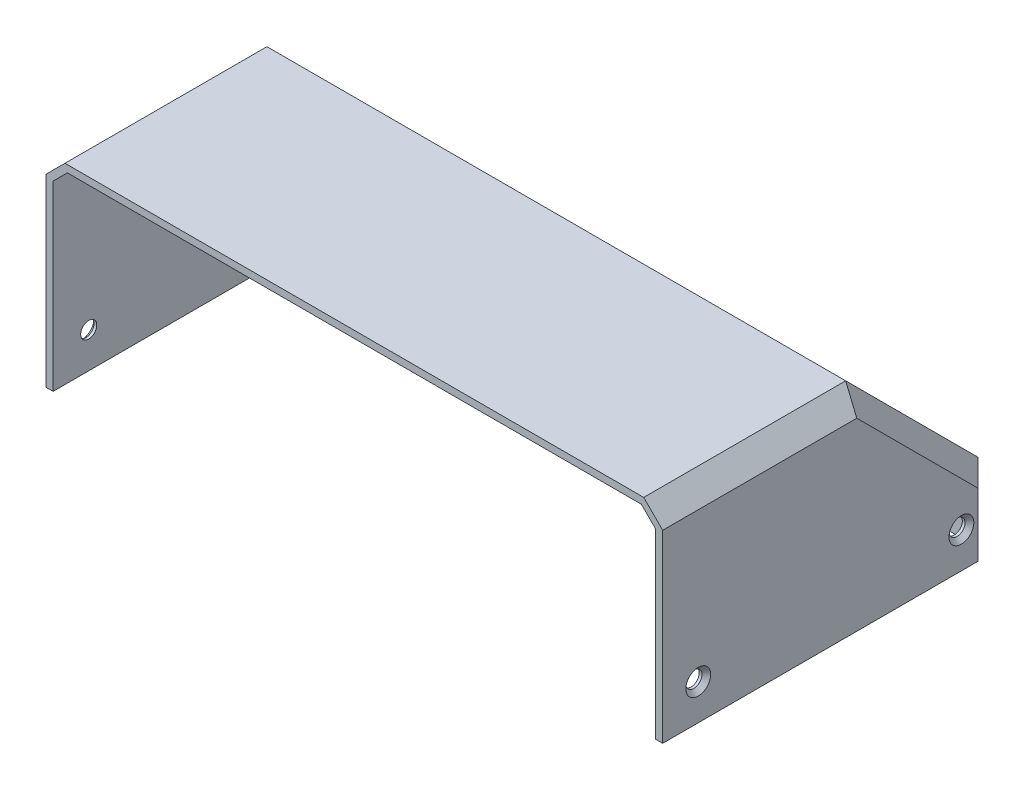
from build123d import *

# Parameters (mm, degrees)
BOSS_EXTRUDE1_DEPTH             = 82.5383335
CUT_EXTRUDE1_DEPTH              = 80.633333
CUT_EXTRUDE1_DEPTH_BACK         = 80.633333
CHAMFER1_SIZE                   = 3.81
CHAMFER2_SIZE                   = 5.08
CUT_EXTRUDE2_REACH              = 114.703
FILL_START                      = 74.838023578
FILL_PATTERN1_DEPTH             = 1.905
F_6_CLEARANCE_HOLE1_D           = 4.3053
F_6_CLEARANCE_HOLE1_DEPTH       = 6.858
F_6_CLEARANCE_HOLE1_CSINK_D     = 6.6548
F_6_CLEARANCE_HOLE1_CSINK_ANGLE = 90
F_6_CLEARANCE_HOLE1_TIP         = 1.293442612
F_6_CLEARANCE_HOLE2_D           = 4.3053
F_6_CLEARANCE_HOLE2_DEPTH       = 6.858
F_6_CLEARANCE_HOLE2_CSINK_D     = 6.6548
F_6_CLEARANCE_HOLE2_CSINK_ANGLE = 90
F_6_CLEARANCE_HOLE2_TIP         = 1.293442612


# Read off the part's stored shape, not the designer's step: Fill Pattern1
with BuildPart() as part:
    # Sketch1 → Boss-Extrude1 (new, symmetric)
    with BuildSketch(Plane(origin=(0, 0, 0), x_dir=(0, 0, -1), z_dir=(1, 0, 0))):
        Polygon((0, 0), (89.481024762, 0), (89.481024762, 19.05), (54.056025762, 54.474999), (0, 54.474999), align=None)
    extrude(amount=BOSS_EXTRUDE1_DEPTH, both=True)

    # Sketch3 → Cut-Extrude1 (cut, two sides: drawn at the far end of the back side and taken through both)
    with BuildSketch(Plane(origin=(0, 51.807175117, 0), x_dir=(0, 0, 1), z_dir=(-1, 0, 0)).offset(-CUT_EXTRUDE1_DEPTH_BACK)):
        Polygon((-87.576024762, -51.807175117), (0, -51.807175117), (0, 0.762823883), (-53.266948926, 0.762823883), (-87.576024762, -33.546251954), align=None)
    extrude(amount=CUT_EXTRUDE1_DEPTH + CUT_EXTRUDE1_DEPTH_BACK, mode=Mode.SUBTRACT)

    # Chamfer1
    chamfer1_edges = [part.edges().sort_by_distance(p)[0] for p in [
        (-80.633333, 9.130461582, -87.576024762),
        (80.633333, 9.130461582, -87.576024762),
        (-80.633333, 35.415461082, -70.421486844),
        (80.633333, 35.415461082, -70.421486844),
        (-80.633333, 52.569999, -26.633474463),
        (80.633333, 52.569999, -26.633474463),
    ]]
    chamfer(chamfer1_edges, length=CHAMFER1_SIZE)

    # Chamfer2
    chamfer2_edges = [part.edges().sort_by_distance(p)[0] for p in [
        (82.5383335, 9.525, -89.481024762),
        (82.5383335, 36.7624995, -71.768525262),
        (82.5383335, 54.474999, -27.028012881),
        (-82.5383335, 54.474999, -27.028012881),
        (-82.5383335, 36.7624995, -71.768525262),
        (-82.5383335, 9.525, -89.481024762),
    ]]
    chamfer(chamfer2_edges, length=CHAMFER2_SIZE)

    # Sketch10 → Cut-Extrude2 (cut, up to next)
    with BuildSketch(Plane(origin=(0, 54.265512381, -54.265512381), x_dir=(1, 0, 0), z_dir=(0, 0.7071067811865515, -0.7071067811865436)), mode=Mode.PRIVATE) as cut_extrude2_sk1:
        Polygon((4.618802155, 24.752998199), (2.309401077, 28.7529982), (-2.309401077, 28.7529982), (-4.618802155, 24.752998199), (-2.309401077, 20.752998198), (2.309401077, 20.752998198), align=None)
    cut_extrude2_tool1 = extrude(cut_extrude2_sk1.sketch, amount=-CUT_EXTRUDE2_REACH, mode=Mode.PRIVATE) & part.part
    add(cut_extrude2_tool1.solids().sort_by_distance((0, 36.7625, -71.768525))[0], mode=Mode.SUBTRACT)

    # Fill Pattern1 outline → Fill Pattern1 (cut)
    with BuildSketch(Plane(origin=(0, 0, 0), x_dir=(1, 0, 0), z_dir=(0, 0.707106781186551, -0.707106781186544)).offset(FILL_START)):
        Polygon((6.350853018, 35.752998297), (10.969655172, 35.752998297), (13.27905625, 39.752998298), (10.969655172, 43.752998299), (6.350853018, 43.752998299), (4.04145194, 39.752998298), align=None)
        Polygon((-10.969655172, 5.752998099), (-6.350853018, 5.752998099), (-4.04145194, 9.7529981), (-6.350853018, 13.752998101), (-10.969655172, 13.752998101), (-13.27905625, 9.7529981), align=None)
        Polygon((-21.939310345, 24.752998199), (-19.629909267, 20.752998198), (-15.011107113, 20.752998198), (-12.701706035, 24.752998199), (-15.011107113, 28.7529982), (-19.629909267, 28.7529982), align=None)
        Polygon((-39.259818535, 24.752998199), (-36.950417457, 20.752998198), (-32.331615303, 20.752998198), (-30.022214225, 24.752998199), (-32.331615303, 28.7529982), (-36.950417457, 28.7529982), align=None)
        Polygon((-56.580326725, 24.752998199), (-54.270925647, 20.752998198), (-49.652123493, 20.752998198), (-47.342722415, 24.752998199), (-49.652123493, 28.7529982), (-54.270925647, 28.7529982), align=None)
        Polygon((47.342722415, 24.752998199), (49.652123493, 20.752998198), (54.270925647, 20.752998198), (56.580326725, 24.752998199), (54.270925647, 28.7529982), (49.652123493, 28.7529982), align=None)
        Polygon((30.022214225, 24.752998199), (32.331615303, 20.752998198), (36.950417457, 20.752998198), (39.259818535, 24.752998199), (36.950417457, 28.7529982), (32.331615303, 28.7529982), align=None)
        Polygon((12.701706035, 24.752998199), (15.011107113, 20.752998198), (19.629909267, 20.752998198), (21.939310345, 24.752998199), (19.629909267, 28.7529982), (15.011107113, 28.7529982), align=None)
        Polygon((-10.969655172, 43.752998299), (-13.27905625, 39.752998298), (-10.969655172, 35.752998297), (-6.350853018, 35.752998297), (-4.04145194, 39.752998298), (-6.350853018, 43.752998299), align=None)
        Polygon((6.350853018, 13.752998101), (4.04145194, 9.7529981), (6.350853018, 5.752998099), (10.969655172, 5.752998099), (13.27905625, 9.7529981), (10.969655172, 13.752998101), align=None)
        Polygon((-54.270925647, 40.75299833), (-49.652123493, 40.75299833), (-47.342722415, 44.752998331), (-49.652123493, 48.752998332), (-54.270925647, 48.752998332), (-56.580326725, 44.752998331), align=None)
        Polygon((-62.931179742, 25.752998231), (-58.312377588, 25.752998231), (-56.00297651, 29.752998232), (-58.312377588, 33.752998233), (-62.931179742, 33.752998233), (-65.24058082, 29.752998232), align=None)
        Polygon((12.701706035, 44.752998331), (15.011107113, 40.75299833), (19.629909267, 40.75299833), (21.939310345, 44.752998331), (19.629909267, 48.752998332), (15.011107113, 48.752998332), align=None)
        Polygon((30.022214225, 44.752998331), (32.331615303, 40.75299833), (36.950417457, 40.75299833), (39.259818535, 44.752998331), (36.950417457, 48.752998332), (32.331615303, 48.752998332), align=None)
        Polygon((-21.939310345, 44.752998331), (-19.629909267, 40.75299833), (-15.011107113, 40.75299833), (-12.701706035, 44.752998331), (-15.011107113, 48.752998332), (-19.629909267, 48.752998332), align=None)
        Polygon((-39.259818535, 44.752998331), (-36.950417457, 40.75299833), (-32.331615303, 40.75299833), (-30.022214225, 44.752998331), (-32.331615303, 48.752998332), (-36.950417457, 48.752998332), align=None)
        Polygon((-4.618802155, 44.752998331), (-2.309401077, 40.75299833), (2.309401077, 40.75299833), (4.618802155, 44.752998331), (2.309401077, 48.752998332), (-2.309401077, 48.752998332), align=None)
        Polygon((47.342722415, 44.752998331), (49.652123493, 40.75299833), (54.270925647, 40.75299833), (56.580326725, 44.752998331), (54.270925647, 48.752998332), (49.652123493, 48.752998332), align=None)
        Polygon((-36.950417457, 18.752998134), (-39.259818535, 14.752998133), (-36.950417457, 10.752998132), (-32.331615303, 10.752998132), (-30.022214225, 14.752998133), (-32.331615303, 18.752998134), align=None)
        Polygon((-45.610671552, 33.752998233), (-47.92007263, 29.752998232), (-45.610671552, 25.752998231), (-40.991869398, 25.752998231), (-38.68246832, 29.752998232), (-40.991869398, 33.752998233), align=None)
        Polygon((49.652123493, 0.752998066), (54.270925647, 0.752998066), (56.580326725, 4.752998067), (54.270925647, 8.752998068), (49.652123493, 8.752998068), (47.342722415, 4.752998067), align=None)
        Polygon((58.312377588, 15.752998165), (62.931179742, 15.752998165), (65.24058082, 19.752998166), (62.931179742, 23.752998167), (58.312377588, 23.752998167), (56.00297651, 19.752998166), align=None)
        Polygon((-56.580326725, 4.752998067), (-54.270925647, 0.752998066), (-49.652123493, 0.752998066), (-47.342722415, 4.752998067), (-49.652123493, 8.752998068), (-54.270925647, 8.752998068), align=None)
        Polygon((-4.618802155, 4.752998067), (-2.309401077, 0.752998066), (2.309401077, 0.752998066), (4.618802155, 4.752998067), (2.309401077, 8.752998068), (-2.309401077, 8.752998068), align=None)
        Polygon((30.022214225, 4.752998067), (32.331615303, 0.752998066), (36.950417457, 0.752998066), (39.259818535, 4.752998067), (36.950417457, 8.752998068), (32.331615303, 8.752998068), align=None)
        Polygon((12.701706035, 4.752998067), (15.011107113, 0.752998066), (19.629909267, 0.752998066), (21.939310345, 4.752998067), (19.629909267, 8.752998068), (15.011107113, 8.752998068), align=None)
        Polygon((-39.259818535, 4.752998067), (-36.950417457, 0.752998066), (-32.331615303, 0.752998066), (-30.022214225, 4.752998067), (-32.331615303, 8.752998068), (-36.950417457, 8.752998068), align=None)
        Polygon((-21.939310345, 4.752998067), (-19.629909267, 0.752998066), (-15.011107113, 0.752998066), (-12.701706035, 4.752998067), (-15.011107113, 8.752998068), (-19.629909267, 8.752998068), align=None)
        Polygon((40.991869398, 23.752998167), (38.68246832, 19.752998166), (40.991869398, 15.752998165), (45.610671552, 15.752998165), (47.92007263, 19.752998166), (45.610671552, 23.752998167), align=None)
        Polygon((32.331615303, 38.752998266), (30.022214225, 34.752998265), (32.331615303, 30.752998264), (36.950417457, 30.752998264), (39.259818535, 34.752998265), (36.950417457, 38.752998266), align=None)
        Polygon((-2.309401077, 30.752998264), (2.309401077, 30.752998264), (4.618802155, 34.752998265), (2.309401077, 38.752998266), (-2.309401077, 38.752998266), (-4.618802155, 34.752998265), align=None)
        Polygon((-10.969655172, 15.752998165), (-6.350853018, 15.752998165), (-4.04145194, 19.752998166), (-6.350853018, 23.752998167), (-10.969655172, 23.752998167), (-13.27905625, 19.752998166), align=None)
        Polygon((12.701706035, 34.752998265), (15.011107113, 30.752998264), (19.629909267, 30.752998264), (21.939310345, 34.752998265), (19.629909267, 38.752998266), (15.011107113, 38.752998266), align=None)
        Polygon((-39.259818535, 34.752998265), (-36.950417457, 30.752998264), (-32.331615303, 30.752998264), (-30.022214225, 34.752998265), (-32.331615303, 38.752998266), (-36.950417457, 38.752998266), align=None)
        Polygon((-56.580326725, 34.752998265), (-54.270925647, 30.752998264), (-49.652123493, 30.752998264), (-47.342722415, 34.752998265), (-49.652123493, 38.752998266), (-54.270925647, 38.752998266), align=None)
        Polygon((-21.939310345, 34.752998265), (-19.629909267, 30.752998264), (-15.011107113, 30.752998264), (-12.701706035, 34.752998265), (-15.011107113, 38.752998266), (-19.629909267, 38.752998266), align=None)
        Polygon((47.342722415, 34.752998265), (49.652123493, 30.752998264), (54.270925647, 30.752998264), (56.580326725, 34.752998265), (54.270925647, 38.752998266), (49.652123493, 38.752998266), align=None)
        Polygon((6.350853018, 23.752998167), (4.04145194, 19.752998166), (6.350853018, 15.752998165), (10.969655172, 15.752998165), (13.27905625, 19.752998166), (10.969655172, 23.752998167), align=None)
        Polygon((21.36196013, 39.752998298), (23.671361208, 35.752998297), (28.290163362, 35.752998297), (30.59956444, 39.752998298), (28.290163362, 43.752998299), (23.671361208, 43.752998299), align=None)
        Polygon((-30.59956444, 39.752998298), (-28.290163362, 35.752998297), (-23.671361208, 35.752998297), (-21.36196013, 39.752998298), (-23.671361208, 43.752998299), (-28.290163362, 43.752998299), align=None)
        Polygon((-65.24058082, 39.752998298), (-62.931179742, 35.752998297), (-58.312377588, 35.752998297), (-56.00297651, 39.752998298), (-58.312377588, 43.752998299), (-62.931179742, 43.752998299), align=None)
        Polygon((-47.92007263, 39.752998298), (-45.610671552, 35.752998297), (-40.991869398, 35.752998297), (-38.68246832, 39.752998298), (-40.991869398, 43.752998299), (-45.610671552, 43.752998299), align=None)
        Polygon((38.68246832, 39.752998298), (40.991869398, 35.752998297), (45.610671552, 35.752998297), (47.92007263, 39.752998298), (45.610671552, 43.752998299), (40.991869398, 43.752998299), align=None)
        Polygon((56.00297651, 39.752998298), (58.312377588, 35.752998297), (62.931179742, 35.752998297), (65.24058082, 39.752998298), (62.931179742, 43.752998299), (58.312377588, 43.752998299), align=None)
        Polygon((23.671361208, 13.752998101), (21.36196013, 9.7529981), (23.671361208, 5.752998099), (28.290163362, 5.752998099), (30.59956444, 9.7529981), (28.290163362, 13.752998101), align=None)
        Polygon((-28.290163362, 5.752998099), (-23.671361208, 5.752998099), (-21.36196013, 9.7529981), (-23.671361208, 13.752998101), (-28.290163362, 13.752998101), (-30.59956444, 9.7529981), align=None)
        Polygon((-10.969655172, 25.752998231), (-6.350853018, 25.752998231), (-4.04145194, 29.752998232), (-6.350853018, 33.752998233), (-10.969655172, 33.752998233), (-13.27905625, 29.752998232), align=None)
        Polygon((-19.629909267, 10.752998132), (-15.011107113, 10.752998132), (-12.701706035, 14.752998133), (-15.011107113, 18.752998134), (-19.629909267, 18.752998134), (-21.939310345, 14.752998133), align=None)
        Polygon((4.04145194, 29.752998232), (6.350853018, 25.752998231), (10.969655172, 25.752998231), (13.27905625, 29.752998232), (10.969655172, 33.752998233), (6.350853018, 33.752998233), align=None)
        Polygon((-30.59956444, 29.752998232), (-28.290163362, 25.752998231), (-23.671361208, 25.752998231), (-21.36196013, 29.752998232), (-23.671361208, 33.752998233), (-28.290163362, 33.752998233), align=None)
        Polygon((56.00297651, 29.752998232), (58.312377588, 25.752998231), (62.931179742, 25.752998231), (65.24058082, 29.752998232), (62.931179742, 33.752998233), (58.312377588, 33.752998233), align=None)
        Polygon((21.36196013, 29.752998232), (23.671361208, 25.752998231), (28.290163362, 25.752998231), (30.59956444, 29.752998232), (28.290163362, 33.752998233), (23.671361208, 33.752998233), align=None)
        Polygon((38.68246832, 29.752998232), (40.991869398, 25.752998231), (45.610671552, 25.752998231), (47.92007263, 29.752998232), (45.610671552, 33.752998233), (40.991869398, 33.752998233), align=None)
        Polygon((-2.309401077, 18.752998134), (-4.618802155, 14.752998133), (-2.309401077, 10.752998132), (2.309401077, 10.752998132), (4.618802155, 14.752998133), (2.309401077, 18.752998134), align=None)
        Polygon((-54.270925647, 10.752998132), (-49.652123493, 10.752998132), (-47.342722415, 14.752998133), (-49.652123493, 18.752998134), (-54.270925647, 18.752998134), (-56.580326725, 14.752998133), align=None)
        Polygon((12.701706035, 14.752998133), (15.011107113, 10.752998132), (19.629909267, 10.752998132), (21.939310345, 14.752998133), (19.629909267, 18.752998134), (15.011107113, 18.752998134), align=None)
        Polygon((47.342722415, 14.752998133), (49.652123493, 10.752998132), (54.270925647, 10.752998132), (56.580326725, 14.752998133), (54.270925647, 18.752998134), (49.652123493, 18.752998134), align=None)
        Polygon((30.022214225, 14.752998133), (32.331615303, 10.752998132), (36.950417457, 10.752998132), (39.259818535, 14.752998133), (36.950417457, 18.752998134), (32.331615303, 18.752998134), align=None)
        Polygon((-45.610671552, 15.752998165), (-40.991869398, 15.752998165), (-38.68246832, 19.752998166), (-40.991869398, 23.752998167), (-45.610671552, 23.752998167), (-47.92007263, 19.752998166), align=None)
        Polygon((-30.59956444, 19.752998166), (-28.290163362, 15.752998165), (-23.671361208, 15.752998165), (-21.36196013, 19.752998166), (-23.671361208, 23.752998167), (-28.290163362, 23.752998167), align=None)
        Polygon((-65.24058082, 19.752998166), (-62.931179742, 15.752998165), (-58.312377588, 15.752998165), (-56.00297651, 19.752998166), (-58.312377588, 23.752998167), (-62.931179742, 23.752998167), align=None)
        Polygon((21.36196013, 19.752998166), (23.671361208, 15.752998165), (28.290163362, 15.752998165), (30.59956444, 19.752998166), (28.290163362, 23.752998167), (23.671361208, 23.752998167), align=None)
        Polygon((-62.931179742, 5.752998099), (-58.312377588, 5.752998099), (-56.00297651, 9.7529981), (-58.312377588, 13.752998101), (-62.931179742, 13.752998101), (-65.24058082, 9.7529981), align=None)
        Polygon((-47.92007263, 9.7529981), (-45.610671552, 5.752998099), (-40.991869398, 5.752998099), (-38.68246832, 9.7529981), (-40.991869398, 13.752998101), (-45.610671552, 13.752998101), align=None)
        Polygon((38.68246832, 9.7529981), (40.991869398, 5.752998099), (45.610671552, 5.752998099), (47.92007263, 9.7529981), (45.610671552, 13.752998101), (40.991869398, 13.752998101), align=None)
        Polygon((56.00297651, 9.7529981), (58.312377588, 5.752998099), (62.931179742, 5.752998099), (65.24058082, 9.7529981), (62.931179742, 13.752998101), (58.312377588, 13.752998101), align=None)
    extrude(amount=FILL_PATTERN1_DEPTH, mode=Mode.SUBTRACT)

    # #6 Clearance Hole1
    with Locations(Plane(origin=(-82.5383335, 0, 1.104999928), x_dir=(0, 0, -1), z_dir=(-1, 0, 0))):
        with Locations((81.06102469, -9.525), (10.629999928, -9.525)):
            CounterSinkHole(F_6_CLEARANCE_HOLE1_D / 2, F_6_CLEARANCE_HOLE1_CSINK_D / 2, depth=F_6_CLEARANCE_HOLE1_DEPTH, counter_sink_angle=F_6_CLEARANCE_HOLE1_CSINK_ANGLE)
            with Locations((0, 0, -(F_6_CLEARANCE_HOLE1_DEPTH + F_6_CLEARANCE_HOLE1_TIP / 2))):  # 118° drill point
                Cone(0, F_6_CLEARANCE_HOLE1_D / 2, F_6_CLEARANCE_HOLE1_TIP, mode=Mode.SUBTRACT)

    # #6 Clearance Hole2
    with Locations(Plane(origin=(82.5383335, 0, -1.104999928), x_dir=(0, 0, 1), z_dir=(1, 0, 0))):
        with Locations((-78.851024834, -9.525), (-8.420000072, -9.525)):
            CounterSinkHole(F_6_CLEARANCE_HOLE2_D / 2, F_6_CLEARANCE_HOLE2_CSINK_D / 2, depth=F_6_CLEARANCE_HOLE2_DEPTH, counter_sink_angle=F_6_CLEARANCE_HOLE2_CSINK_ANGLE)
            with Locations((0, 0, -(F_6_CLEARANCE_HOLE2_DEPTH + F_6_CLEARANCE_HOLE2_TIP / 2))):  # 118° drill point
                Cone(0, F_6_CLEARANCE_HOLE2_D / 2, F_6_CLEARANCE_HOLE2_TIP, mode=Mode.SUBTRACT)


solid = part.part
